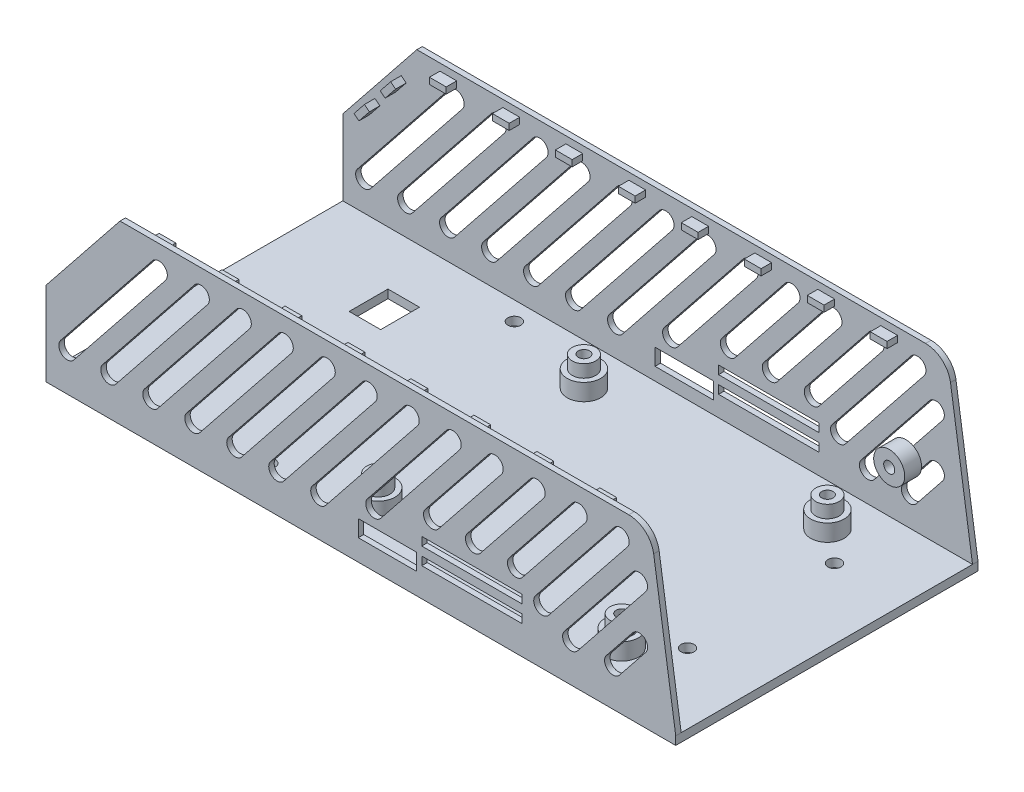
from build123d import *

# Parameters (mm, degrees)
SKETCH_1_W               = 150
SKETCH_1_H               = 72
EXTRUDE_353_DEPTH        = 2
SKETCH_2_R               = 4
EXTRUDE_552_DEPTH        = 7
CUT_EXTRUDE_M2_5_DEPTH   = 5
CUT_EXTRUDE_M2_5_2_REACH = 135.916
SKETCH_4_R               = 1.35
CUT_EXTRUDE_START        = -3
SKETCH_6_R               = 4
SKETCH_6_R_2             = 2.794428219
CUT_EXTRUDE_3_DEPTH      = 3
SKETCH_1271_W            = 23.879073069
SKETCH_1271_H            = 2
SKETCH_1271_W_2          = 13.873866224
SKETCH_1271_H_2          = 3.944574251
EXTRUDE_2203_DEPTH       = 1.3
SKETCH_14_W              = 4
SKETCH_14_H              = 1.5
EXTRUDE_2776_DEPTH       = 2.5
SKETCH_17_W              = 7.5
SKETCH_17_H              = 9.25
SKETCH_17_R              = 1.55
CUT_EXTRUDE_3949_DEPTH   = 2.5
SKETCH_10_R              = 3.7
EXTRUDE_5_DEPTH          = 4
CUT_EXTRUDE_4_REACH      = 137.873
SKETCH_11_R              = 1.32
SKETCH_12_R              = 2.5
CUT_EXTRUDE_5_DEPTH      = 3


with BuildPart() as part:
    # 草图1 → Extrude 353 (new body)
    with BuildSketch(Plane(origin=(0, 0, 0), x_dir=(1, 0, 0), z_dir=(0, 1, 0))):
        with Locations((36.41172395, 38.133946477)):
            Rectangle(SKETCH_1_W, SKETCH_1_H)
    extrude(amount=-EXTRUDE_353_DEPTH)

    # 草图2 → Extrude 552 (add)
    with BuildSketch(Plane(origin=(0, 0, 0), x_dir=(1, 0, 0), z_dir=(0, 1, 0))):
        with Locations((28.75484872, 13.928985193)):
            Circle(SKETCH_2_R)
        with Locations((86.75484872, 13.928985193)):
            Circle(SKETCH_2_R)
        with Locations((86.75484872, 62.928985193)):
            Circle(SKETCH_2_R)
        with Locations((28.75484872, 62.928985193)):
            Circle(SKETCH_2_R)
    extrude(amount=EXTRUDE_552_DEPTH)

    # Sketch 597 → Cut-Extrude m2.5 (cut)
    with BuildSketch(Plane.XZ.offset(2)):
        Polygon((88.785171308, -11.717396732), (85.854718224, -11.064880023), (83.824395636, -13.276468484), (84.724526132, -16.140573654), (87.654979216, -16.793090363), (89.685301804, -14.581501902), align=None)
        Polygon((30.785171308, -11.717396732), (27.854718224, -11.064880023), (25.824395636, -13.276468484), (26.724526132, -16.140573654), (29.654979216, -16.793090363), (31.685301804, -14.581501902), align=None)
        Polygon((88.785171308, -60.717396732), (85.854718224, -60.064880023), (83.824395636, -62.276468484), (84.724526132, -65.140573654), (87.654979216, -65.793090363), (89.685301804, -63.581501902), align=None)
        Polygon((30.785171308, -60.717396732), (27.854718224, -60.064880023), (25.824395636, -62.276468484), (26.724526132, -65.140573654), (29.654979216, -65.793090363), (31.685301804, -63.581501902), align=None)
    extrude(amount=-CUT_EXTRUDE_M2_5_DEPTH, mode=Mode.SUBTRACT)

    # 草图4 → Cut-Extrude m2.5 2 (cut, up to next)
    with BuildSketch(Plane.XZ.offset(-3), mode=Mode.PRIVATE) as cut_extrude_m2_5_2_sk1:
        with Locations((28.75484872, -13.928985193)):
            Circle(SKETCH_4_R)
    cut_extrude_m2_5_2_tool1 = extrude(cut_extrude_m2_5_2_sk1.sketch, amount=-CUT_EXTRUDE_M2_5_2_REACH, mode=Mode.PRIVATE) & part.part
    # 草图4 → Cut-Extrude m2.5 2 (cut, up to next)
    with BuildSketch(Plane.XZ.offset(-3), mode=Mode.PRIVATE) as cut_extrude_m2_5_2_sk2:
        with Locations((86.75484872, -13.928985193)):
            Circle(SKETCH_4_R)
    cut_extrude_m2_5_2_tool2 = extrude(cut_extrude_m2_5_2_sk2.sketch, amount=-CUT_EXTRUDE_M2_5_2_REACH, mode=Mode.PRIVATE) & part.part
    # 草图4 → Cut-Extrude m2.5 2 (cut, up to next)
    with BuildSketch(Plane.XZ.offset(-3), mode=Mode.PRIVATE) as cut_extrude_m2_5_2_sk3:
        with Locations((86.75484872, -62.928985193)):
            Circle(SKETCH_4_R)
    cut_extrude_m2_5_2_tool3 = extrude(cut_extrude_m2_5_2_sk3.sketch, amount=-CUT_EXTRUDE_M2_5_2_REACH, mode=Mode.PRIVATE) & part.part
    # 草图4 → Cut-Extrude m2.5 2 (cut, up to next)
    with BuildSketch(Plane.XZ.offset(-3), mode=Mode.PRIVATE) as cut_extrude_m2_5_2_sk4:
        with Locations((28.75484872, -62.928985193)):
            Circle(SKETCH_4_R)
    cut_extrude_m2_5_2_tool4 = extrude(cut_extrude_m2_5_2_sk4.sketch, amount=-CUT_EXTRUDE_M2_5_2_REACH, mode=Mode.PRIVATE) & part.part
    add(cut_extrude_m2_5_2_tool1.solids().sort_by_distance((28.754849, 3, -13.928985))[0], mode=Mode.SUBTRACT)
    add(cut_extrude_m2_5_2_tool2.solids().sort_by_distance((86.754849, 3, -13.928985))[0], mode=Mode.SUBTRACT)
    add(cut_extrude_m2_5_2_tool3.solids().sort_by_distance((86.754849, 3, -62.928985))[0], mode=Mode.SUBTRACT)
    add(cut_extrude_m2_5_2_tool4.solids().sort_by_distance((28.754849, 3, -62.928985))[0], mode=Mode.SUBTRACT)

    # 草图6 → 切除-拉伸3 (cut)
    # profile 1 of 4: a face of its own
    with BuildSketch(Plane(origin=(0, 7, 0), x_dir=(1, 0, 0), z_dir=(0, 1, 0)).offset(CUT_EXTRUDE_START)):
        with Locations((28.75484872, 13.928985193)):
            Circle(SKETCH_6_R)
        with Locations((28.75484872, 13.928985193)):
            Circle(SKETCH_6_R_2, mode=Mode.SUBTRACT)
    # profile 2 of 4: a face of its own
    with BuildSketch(Plane(origin=(0, 7, 0), x_dir=(1, 0, 0), z_dir=(0, 1, 0)).offset(CUT_EXTRUDE_START)):
        with Locations((86.75484872, 13.928985193)):
            Circle(SKETCH_6_R)
        with Locations((86.75484872, 13.928985193)):
            Circle(SKETCH_6_R_2, mode=Mode.SUBTRACT)
    # profile 3 of 4: a face of its own
    with BuildSketch(Plane(origin=(0, 7, 0), x_dir=(1, 0, 0), z_dir=(0, 1, 0)).offset(CUT_EXTRUDE_START)):
        with Locations((86.75484872, 62.928985193)):
            Circle(SKETCH_6_R)
        with Locations((86.75484872, 62.928985193)):
            Circle(SKETCH_6_R_2, mode=Mode.SUBTRACT)
    # profile 4 of 4: a face of its own
    with BuildSketch(Plane(origin=(0, 7, 0), x_dir=(1, 0, 0), z_dir=(0, 1, 0)).offset(CUT_EXTRUDE_START)):
        with Locations((28.75484872, 62.928985193)):
            Circle(SKETCH_6_R)
        with Locations((28.75484872, 62.928985193)):
            Circle(SKETCH_6_R_2, mode=Mode.SUBTRACT)
    extrude(amount=CUT_EXTRUDE_3_DEPTH, mode=Mode.SUBTRACT)

    # Sketch 1271 → Extrude 2203 (add)
    with BuildSketch(Plane(origin=(0, 0, -74.133946477), x_dir=(-1, 0, 0), z_dir=(0, 0, -1))):
        with BuildLine():
            Line((-111.41172395, 0), (38.58827605, 0))
            Line((38.58827605, 0), (38.58827605, 17.944664202))
            Line((38.58827605, 17.944664202), (20.958907586, 40))
            Line((20.958907586, 40), (-100.225410385, 40))
            ThreePointArc((-100.225410385, 40), (-104.139525694, 38.547493963), (-106.158548965, 34.893233782))
            Line((-106.158548965, 34.893233782), (-111.41172395, 0))
        make_face()
        with Locations((-62.854810914, 5.838076596)):
            Rectangle(SKETCH_1271_W, SKETCH_1271_H, mode=Mode.SUBTRACT)
        with Locations((-62.854810914, 9.895875112)):
            Rectangle(SKETCH_1271_W, SKETCH_1271_H, mode=Mode.SUBTRACT)
        with Locations((-42.731701964, 5.027712875)):
            Rectangle(SKETCH_1271_W_2, SKETCH_1271_H_2, mode=Mode.SUBTRACT)
        with BuildLine():
            Line((31.975272266, 5.823111001), (10.122209654, 33.162526768))
            ThreePointArc((10.122209654, 33.162526768), (10.435715549, 35.973525532), (13.246714313, 35.660019638))
            Line((13.246714313, 35.660019638), (35.099776925, 8.320603871))
            ThreePointArc((35.099776925, 8.320603871), (34.786271031, 5.509605106), (31.975272266, 5.823111001))
        make_face(mode=Mode.SUBTRACT)
        with BuildLine():
            Line((21.975272266, 5.823111001), (0.122209654, 33.162526768))
            ThreePointArc((0.122209654, 33.162526768), (0.435715549, 35.973525532), (3.246714313, 35.660019638))
            Line((3.246714313, 35.660019638), (25.099776925, 8.320603871))
            ThreePointArc((25.099776925, 8.320603871), (24.786271031, 5.509605106), (21.975272266, 5.823111001))
        make_face(mode=Mode.SUBTRACT)
        with BuildLine():
            Line((11.975272266, 5.823111001), (-9.877790346, 33.162526768))
            ThreePointArc((-9.877790346, 33.162526768), (-9.564284451, 35.973525532), (-6.753285687, 35.660019638))
            Line((-6.753285687, 35.660019638), (15.099776925, 8.320603871))
            ThreePointArc((15.099776925, 8.320603871), (14.786271031, 5.509605106), (11.975272266, 5.823111001))
        make_face(mode=Mode.SUBTRACT)
        with BuildLine():
            Line((1.975272266, 5.823111001), (-19.877790346, 33.162526768))
            ThreePointArc((-19.877790346, 33.162526768), (-19.564284451, 35.973525532), (-16.753285687, 35.660019638))
            Line((-16.753285687, 35.660019638), (5.099776925, 8.320603871))
            ThreePointArc((5.099776925, 8.320603871), (4.786271031, 5.509605106), (1.975272266, 5.823111001))
        make_face(mode=Mode.SUBTRACT)
        with BuildLine():
            Line((-8.024727734, 5.823111001), (-29.877790346, 33.162526768))
            ThreePointArc((-29.877790346, 33.162526768), (-29.564284451, 35.973525532), (-26.753285687, 35.660019638))
            Line((-26.753285687, 35.660019638), (-4.900223075, 8.320603871))
            ThreePointArc((-4.900223075, 8.320603871), (-5.213728969, 5.509605106), (-8.024727734, 5.823111001))
        make_face(mode=Mode.SUBTRACT)
        with BuildLine():
            Line((-18.024727734, 5.823111001), (-39.877790346, 33.162526768))
            ThreePointArc((-39.877790346, 33.162526768), (-39.564284451, 35.973525532), (-36.753285687, 35.660019638))
            Line((-36.753285687, 35.660019638), (-14.900223075, 8.320603871))
            ThreePointArc((-14.900223075, 8.320603871), (-15.213728969, 5.509605106), (-18.024727734, 5.823111001))
        make_face(mode=Mode.SUBTRACT)
        with BuildLine():
            Line((-28.024727734, 5.823111001), (-49.877790346, 33.162526768))
            ThreePointArc((-49.877790346, 33.162526768), (-49.564284451, 35.973525532), (-46.753285687, 35.660019638))
            Line((-46.753285687, 35.660019638), (-24.900223075, 8.320603871))
            ThreePointArc((-24.900223075, 8.320603871), (-25.213728969, 5.509605106), (-28.024727734, 5.823111001))
        make_face(mode=Mode.SUBTRACT)
        with BuildLine():
            Line((-41.146593821, 9.728741825), (-59.877790346, 33.162526768))
            ThreePointArc((-59.877790346, 33.162526768), (-59.564284451, 35.973525532), (-56.753285687, 35.660019638))
            Line((-56.753285687, 35.660019638), (-38.022089162, 12.226234695))
            ThreePointArc((-38.022089162, 12.226234695), (-38.335595057, 9.41523593), (-41.146593821, 9.728741825))
        make_face(mode=Mode.SUBTRACT)
        with BuildLine():
            Line((-54.892833126, 14.415498813), (-69.877790346, 33.162526768))
            ThreePointArc((-69.877790346, 33.162526768), (-69.564284451, 35.973525532), (-66.753285687, 35.660019638))
            Line((-66.753285687, 35.660019638), (-51.768328467, 16.912991683))
            ThreePointArc((-51.768328467, 16.912991683), (-52.081834362, 14.101992919), (-54.892833126, 14.415498813))
        make_face(mode=Mode.SUBTRACT)
        with BuildLine():
            Line((-64.892833126, 14.415498813), (-79.877790346, 33.162526768))
            ThreePointArc((-79.877790346, 33.162526768), (-79.564284451, 35.973525532), (-76.753285687, 35.660019638))
            Line((-76.753285687, 35.660019638), (-61.768328467, 16.912991683))
            ThreePointArc((-61.768328467, 16.912991683), (-62.081834362, 14.101992919), (-64.892833126, 14.415498813))
        make_face(mode=Mode.SUBTRACT)
        with BuildLine():
            Line((-74.892833126, 14.415498813), (-89.877790346, 33.162526768))
            ThreePointArc((-89.877790346, 33.162526768), (-89.564284451, 35.973525532), (-86.753285687, 35.660019638))
            Line((-86.753285687, 35.660019638), (-71.768328467, 16.912991683))
            ThreePointArc((-71.768328467, 16.912991683), (-72.081834362, 14.101992919), (-74.892833126, 14.415498813))
        make_face(mode=Mode.SUBTRACT)
        with BuildLine():
            Line((-81.146593821, 9.728741825), (-99.877790346, 33.162526768))
            ThreePointArc((-99.877790346, 33.162526768), (-99.564284451, 35.973525532), (-96.753285687, 35.660019638))
            Line((-96.753285687, 35.660019638), (-78.022089162, 12.226234695))
            ThreePointArc((-78.022089162, 12.226234695), (-78.335595057, 9.41523593), (-81.146593821, 9.728741825))
        make_face(mode=Mode.SUBTRACT)
        with BuildLine():
            Line((-88.024727734, 5.823111001), (-104.258431388, 26.132391285))
            ThreePointArc((-104.258431388, 26.132391285), (-103.944925494, 28.943390049), (-101.133926729, 28.629884155))
            Line((-101.133926729, 28.629884155), (-84.900223075, 8.320603871))
            ThreePointArc((-84.900223075, 8.320603871), (-85.213728969, 5.509605106), (-88.024727734, 5.823111001))
        make_face(mode=Mode.SUBTRACT)
        with BuildLine():
            Line((-98.024727734, 5.823111001), (-104.268459909, 13.634372649))
            ThreePointArc((-104.268459909, 13.634372649), (-103.954954014, 16.445371413), (-101.143955249, 16.131865519))
            Line((-101.143955249, 16.131865519), (-94.900223075, 8.320603871))
            ThreePointArc((-94.900223075, 8.320603871), (-95.213728969, 5.509605106), (-98.024727734, 5.823111001))
        make_face(mode=Mode.SUBTRACT)
    extrude_2203 = extrude(amount=-EXTRUDE_2203_DEPTH)

    # 草图14 → Extrude 2776 (add)
    with BuildSketch(Plane.XY.offset(-72.833946477)):
        Polygon((-30.926248063, 24.967724149), (-33.423740933, 21.84321949), (-32.252051685, 20.906659664), (-29.754558815, 24.031164323), align=None)
        Polygon((-24.682515888, 32.778985797), (-27.180008758, 29.654481138), (-26.00831951, 28.717921311), (-23.51082664, 31.84242597), align=None)
        with Locations((-13.454380934, 37.57)):
            Rectangle(SKETCH_14_W, SKETCH_14_H)
        with Locations((1.545619066, 37.57)):
            Rectangle(SKETCH_14_W, SKETCH_14_H)
        with Locations((16.545619066, 37.57)):
            Rectangle(SKETCH_14_W, SKETCH_14_H)
        with Locations((31.545619066, 37.57)):
            Rectangle(SKETCH_14_W, SKETCH_14_H)
        with Locations((46.545619066, 37.57)):
            Rectangle(SKETCH_14_W, SKETCH_14_H)
        with Locations((61.545619066, 37.57)):
            Rectangle(SKETCH_14_W, SKETCH_14_H)
        with Locations((76.545619066, 37.57)):
            Rectangle(SKETCH_14_W, SKETCH_14_H)
        with Locations((91.545619066, 37.57)):
            Rectangle(SKETCH_14_W, SKETCH_14_H)
    extrude_2776 = extrude(amount=EXTRUDE_2776_DEPTH)

    # 镜向1: Extrude 2203, Extrude 2776 across plane
    add(extrude_2203.mirror(Plane(origin=(0, 0, -38.133946477), x_dir=(1, 0, 0), z_dir=(0, 0, -1))))
    add(extrude_2776.mirror(Plane(origin=(0, 0, -38.133946477), x_dir=(1, 0, 0), z_dir=(0, 0, -1))))

    # 草图17 → Cut-Extrude 3949 (cut)
    with BuildSketch(Plane.XZ.offset(2)):
        with Locations((-11.268241823, -55.398909551)):
            Rectangle(SKETCH_17_W, SKETCH_17_H)
        with Locations((6.731758177, -68.373909551)):
            Circle(SKETCH_17_R)
        with Locations((94.731758177, -56.623909551)):
            Circle(SKETCH_17_R)
        with Locations((94.731758177, -21.623909551)):
            Circle(SKETCH_17_R)
        with Locations((6.731758177, -9.873909551)):
            Circle(SKETCH_17_R)
    extrude(amount=-CUT_EXTRUDE_3949_DEPTH, mode=Mode.SUBTRACT)

    # 草图10 → 凸台-拉伸5 (add)
    with BuildSketch(Plane.XY.offset(-72.833946477)):
        with Locations((95.562689868, 14.116021826)):
            Circle(SKETCH_10_R)
    extrude(amount=EXTRUDE_5_DEPTH)

    # 草图11 → 切除-拉伸4 (cut, up to next)
    with BuildSketch(Plane.XY.offset(-68.833946477), mode=Mode.PRIVATE) as cut_extrude_4_sk1:
        with Locations((95.562689868, 14.116021826)):
            Circle(SKETCH_11_R)
    cut_extrude_4_tool1 = extrude(cut_extrude_4_sk1.sketch, amount=-CUT_EXTRUDE_4_REACH, mode=Mode.PRIVATE) & part.part
    add(cut_extrude_4_tool1.solids().sort_by_distance((95.56269, 14.116022, -68.833946))[0], mode=Mode.SUBTRACT)

    # 草图12 → 切除-拉伸5 (cut)
    with BuildSketch(Plane(origin=(0, 0, -74.133946477), x_dir=(-1, 0, 0), z_dir=(0, 0, -1))):
        with Locations((-95.562689868, 14.116021826)):
            Circle(SKETCH_12_R)
    extrude(amount=-CUT_EXTRUDE_5_DEPTH, mode=Mode.SUBTRACT)


solid = part.part
